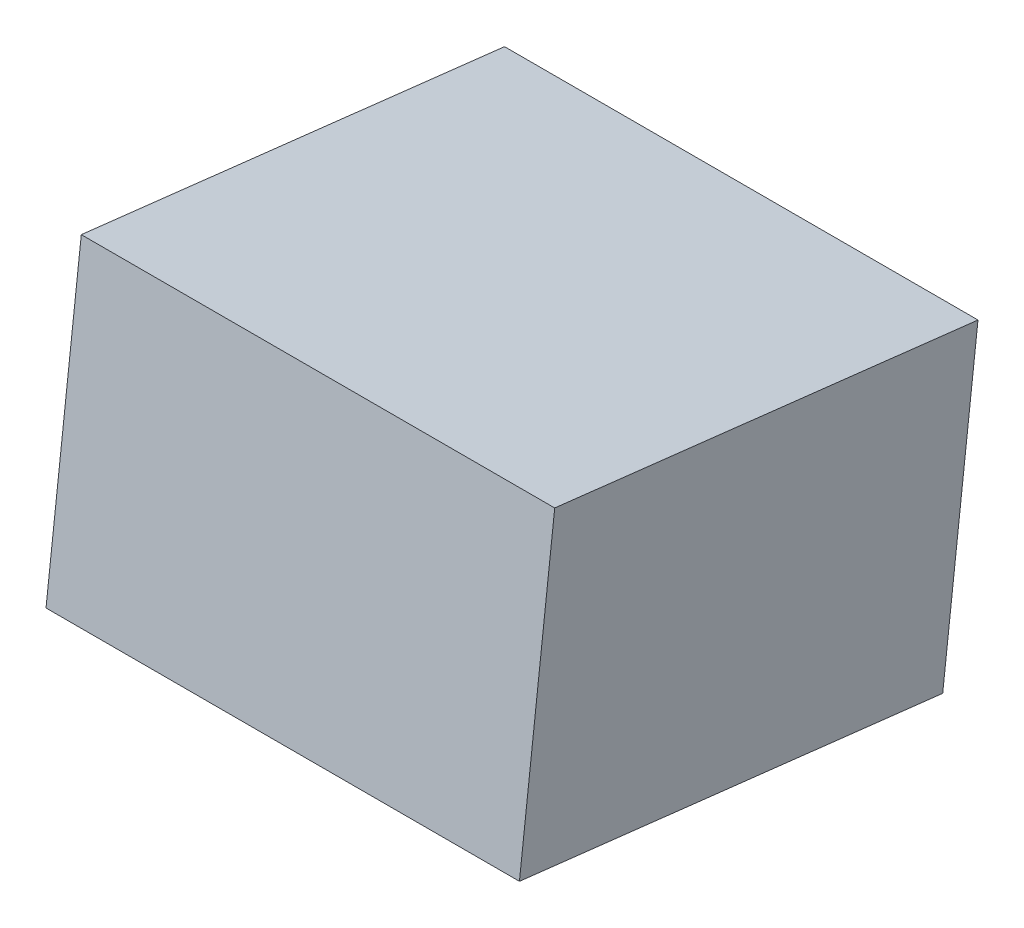
from build123d import *

# Parameters (mm, degrees)
SKETCH1_W           = 200
SKETCH1_H           = 180
BOSS_EXTRUDE1_DEPTH = 130


with BuildPart() as part:
    # Sketch1 → Boss-Extrude1 (new body)
    with BuildSketch(Plane(origin=(0, 343.978805368, -39.702551724), x_dir=(1, 0, 0), z_dir=(-6.837425950214788e-15, 0.9934047622419533, -0.1146602736566085))):
        with Locations((-135, 150.244347434)):
            Rectangle(SKETCH1_W, SKETCH1_H)
    extrude(amount=BOSS_EXTRUDE1_DEPTH)


solid = part.part
